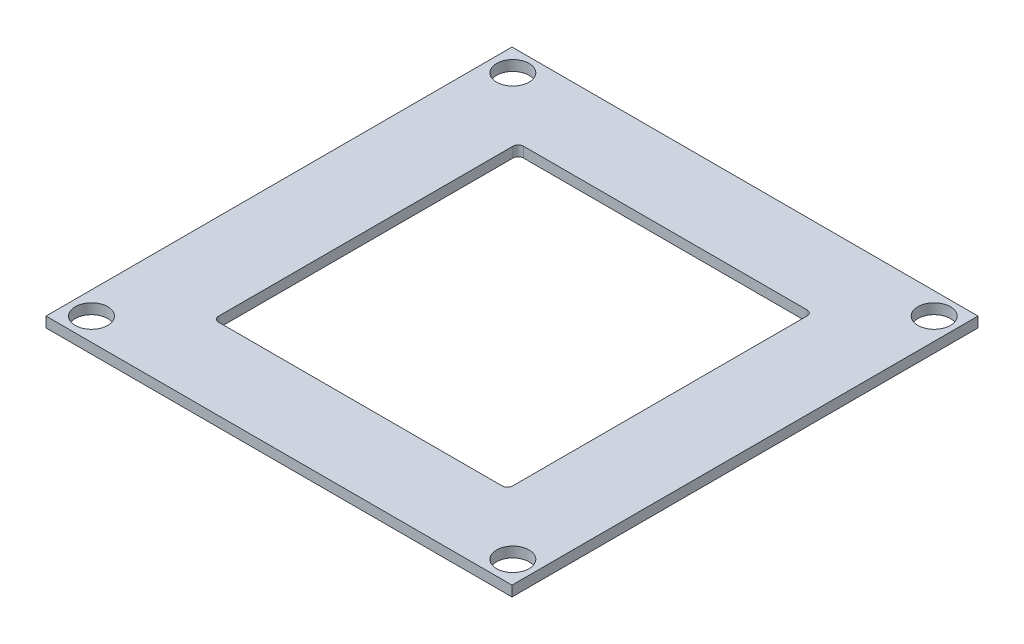
from build123d import *

# Parameters (mm, degrees)
SKETCH1_W           = 286.791999948
SKETCH1_H           = 286.791999948
BOSS_EXTRUDE1_DEPTH = 6.35
SKETCH2_R           = 10
SKETCH2_W           = 180.979932016
SKETCH2_H           = 187.647432016
CUT_EXTRUDE1_DEPTH  = 6.35
FILLET1_R           = 3.175


with BuildPart() as part:
    # Sketch1 → Boss-Extrude1 (new body)
    with BuildSketch(Plane(origin=(0, 0, 0), x_dir=(1, 0, 0), z_dir=(0, 1, 0))):
        with Locations((143.395999974, 0)):
            Rectangle(SKETCH1_W, SKETCH1_H)
    extrude(amount=BOSS_EXTRUDE1_DEPTH)

    # Sketch2 → Cut-Extrude1 (cut)
    with BuildSketch(Plane.XZ):
        with Locations((273.299999948, -129.903999974)):
            Circle(SKETCH2_R)
        with Locations((14, -129.903999974)):
            Circle(SKETCH2_R)
        with Locations((14, 129.395999974)):
            Circle(SKETCH2_R)
        with Locations((273.299999948, 129.395999974)):
            Circle(SKETCH2_R)
        with Locations((143.649999974, -0.254)):
            Rectangle(SKETCH2_W, SKETCH2_H)
    extrude(amount=-CUT_EXTRUDE1_DEPTH, mode=Mode.SUBTRACT)

    # Fillet1
    fillet1_edges = [part.edges().sort_by_distance(p)[0] for p in [
        (53.160033966, 3.175, -94.077716008),
        (234.139965982, 3.175, -94.077716008),
        (234.139965982, 3.175, 93.569716008),
        (53.160033966, 3.175, 93.569716008),
    ]]
    fillet(fillet1_edges, radius=FILLET1_R)


solid = part.part
